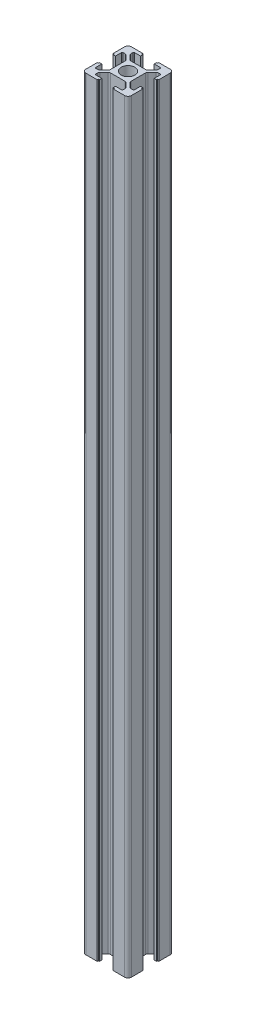
from build123d import *

# Parameters (mm, degrees)
BOSS_EXTRU_1_CORPS_DEPTH    = 335
CONG_1_R                    = 1.5
CONG_2_R                    = 0.4
CONG_4_R                    = 1
CONG_1_OF_SYM_TRIE_BRAS_R   = 1.5
CONG_2_OF_SYM_TRIE_BRAS_R   = 0.4
CONG_4_OF_SYM_TRIE_BRAS_R   = 1
SYM_TRIE_BRAS_DOUBLE_DEPTH  = 335
APR_S_TARODAGE_M6_R         = 3
ENL_V_MAT_FILETAGE_M6_DEPTH = 336.298374586


# Read off the part's stored shape, not the designer's step: Symétrie Bras double
with BuildPart() as part:
    # Esquisse4 → Boss.-Extru.1 Corps (new body)
    with BuildSketch(Plane(origin=(0, 0, 0), x_dir=(1, 0, 0), z_dir=(0, 1, 0))):
        Polygon((0, 0), (-4.5, 0), (-4.5, 3.625), (-6.875, 6), (-8.5, 6), (-8.5, 3), (-9.5, 3), (-9.5, 3.5), (-10, 3.5), (-10, 10), (-3.5, 10), (-3.5, 9.5), (-3, 9.5), (-3, 8.5), (-6, 8.5), (-6, 6.875), (-3.625, 4.5), (0, 4.5), align=None)
    boss_extru_1_corps = extrude(amount=BOSS_EXTRU_1_CORPS_DEPTH)

    # Congé1
    cong_1_edges = [part.edges().sort_by_distance(p)[0] for p in [
        (-10, 167.5, -10),
    ]]
    fillet(cong_1_edges, radius=CONG_1_R)

    # Congé2
    cong_2_edges = [part.edges().sort_by_distance(p)[0] for p in [
        (-8.5, 167.5, -6),
        (-6, 167.5, -8.5),
    ]]
    fillet(cong_2_edges, radius=CONG_2_R)

    # Congé4
    cong_4_edges = [part.edges().sort_by_distance(p)[0] for p in [
        (-4.5, 167.5, -3.625),
        (-6.875, 167.5, -6),
        (-6, 167.5, -6.875),
        (-3.625, 167.5, -4.5),
    ]]
    fillet(cong_4_edges, radius=CONG_4_R)

    # Symétrie Bras: Boss.-Extru.1 Corps across plane
    add(boss_extru_1_corps.mirror(Plane(origin=(0, 335, -4.5), x_dir=(0, 0, 1), z_dir=(-1, 0, 0))))

    # Congé1 of Symétrie Bras
    cong_1_of_sym_trie_bras_edges = [part.edges().sort_by_distance(p)[0] for p in [
        (10, 167.5, -10),
    ]]
    fillet(cong_1_of_sym_trie_bras_edges, radius=CONG_1_OF_SYM_TRIE_BRAS_R)

    # Congé2 of Symétrie Bras
    cong_2_of_sym_trie_bras_edges = [part.edges().sort_by_distance(p)[0] for p in [
        (8.5, 167.5, -6),
        (6, 167.5, -8.5),
    ]]
    fillet(cong_2_of_sym_trie_bras_edges, radius=CONG_2_OF_SYM_TRIE_BRAS_R)

    # Congé4 of Symétrie Bras
    cong_4_of_sym_trie_bras_edges = [part.edges().sort_by_distance(p)[0] for p in [
        (4.5, 167.5, -3.625),
        (6.875, 167.5, -6),
        (6, 167.5, -6.875),
        (3.625, 167.5, -4.5),
    ]]
    fillet(cong_4_of_sym_trie_bras_edges, radius=CONG_4_OF_SYM_TRIE_BRAS_R)

    # Symétrie Bras double outline → Symétrie Bras double (add)
    with BuildSketch(Plane(origin=(0, 0, 0), x_dir=(1, 0, 0), z_dir=(0, 1, 0))):
        with BuildLine():
            ThreePointArc((7.289213562, -6), (6.90653013, -5.923879533), (6.582106781, -5.707106781))
            Line((6.582106781, -5.707106781), (4.792893219, -3.917893219))
            ThreePointArc((4.792893219, -3.917893219), (4.576120467, -3.59346987), (4.5, -3.210786438))
            Line((4.5, -3.210786438), (4.5, 0))
            Line((4.5, 0), (-4.5, 0))
            Line((-4.5, 0), (-4.5, -3.210786438))
            ThreePointArc((-4.5, -3.210786438), (-4.576120467, -3.59346987), (-4.792893219, -3.917893219))
            Line((-4.792893219, -3.917893219), (-6.582106781, -5.707106781))
            ThreePointArc((-6.582106781, -5.707106781), (-6.90653013, -5.923879533), (-7.289213562, -6))
            Line((-7.289213562, -6), (-8.1, -6))
            ThreePointArc((-8.1, -6), (-8.382842712, -5.882842712), (-8.5, -5.6))
            Line((-8.5, -5.6), (-8.5, -3))
            Line((-8.5, -3), (-9.5, -3))
            Line((-9.5, -3), (-9.5, -3.5))
            Line((-9.5, -3.5), (-10, -3.5))
            Line((-10, -3.5), (-10, -8.5))
            ThreePointArc((-10, -8.5), (-9.560660172, -9.560660172), (-8.5, -10))
            Line((-8.5, -10), (-3.5, -10))
            Line((-3.5, -10), (-3.5, -9.5))
            Line((-3.5, -9.5), (-3, -9.5))
            Line((-3, -9.5), (-3, -8.5))
            Line((-3, -8.5), (-5.6, -8.5))
            ThreePointArc((-5.6, -8.5), (-5.882842712, -8.382842712), (-6, -8.1))
            Line((-6, -8.1), (-6, -7.289213562))
            ThreePointArc((-6, -7.289213562), (-5.923879533, -6.90653013), (-5.707106781, -6.582106781))
            Line((-5.707106781, -6.582106781), (-3.917893219, -4.792893219))
            ThreePointArc((-3.917893219, -4.792893219), (-3.59346987, -4.576120467), (-3.210786438, -4.5))
            Line((-3.210786438, -4.5), (3.210786438, -4.5))
            ThreePointArc((3.210786438, -4.5), (3.59346987, -4.576120467), (3.917893219, -4.792893219))
            Line((3.917893219, -4.792893219), (5.707106781, -6.582106781))
            ThreePointArc((5.707106781, -6.582106781), (5.923879533, -6.90653013), (6, -7.289213562))
            Line((6, -7.289213562), (6, -8.1))
            ThreePointArc((6, -8.1), (5.882842712, -8.382842712), (5.6, -8.5))
            Line((5.6, -8.5), (3, -8.5))
            Line((3, -8.5), (3, -9.5))
            Line((3, -9.5), (3.5, -9.5))
            Line((3.5, -9.5), (3.5, -10))
            Line((3.5, -10), (8.5, -10))
            ThreePointArc((8.5, -10), (9.560660172, -9.560660172), (10, -8.5))
            Line((10, -8.5), (10, -3.5))
            Line((10, -3.5), (9.5, -3.5))
            Line((9.5, -3.5), (9.5, -3))
            Line((9.5, -3), (8.5, -3))
            Line((8.5, -3), (8.5, -5.6))
            ThreePointArc((8.5, -5.6), (8.382842712, -5.882842712), (8.1, -6))
            Line((8.1, -6), (7.289213562, -6))
        make_face()
    extrude(amount=SYM_TRIE_BRAS_DOUBLE_DEPTH)

    # Après tarodage M6 → Enlèv. mat.-Filetage M6 (cut, through all)
    with BuildSketch(Plane.XZ):
        with Locations(Location((0, 0, 0), (0, 0, 270))):
            Circle(APR_S_TARODAGE_M6_R)
    extrude(amount=-ENL_V_MAT_FILETAGE_M6_DEPTH, mode=Mode.SUBTRACT)


solid = part.part
